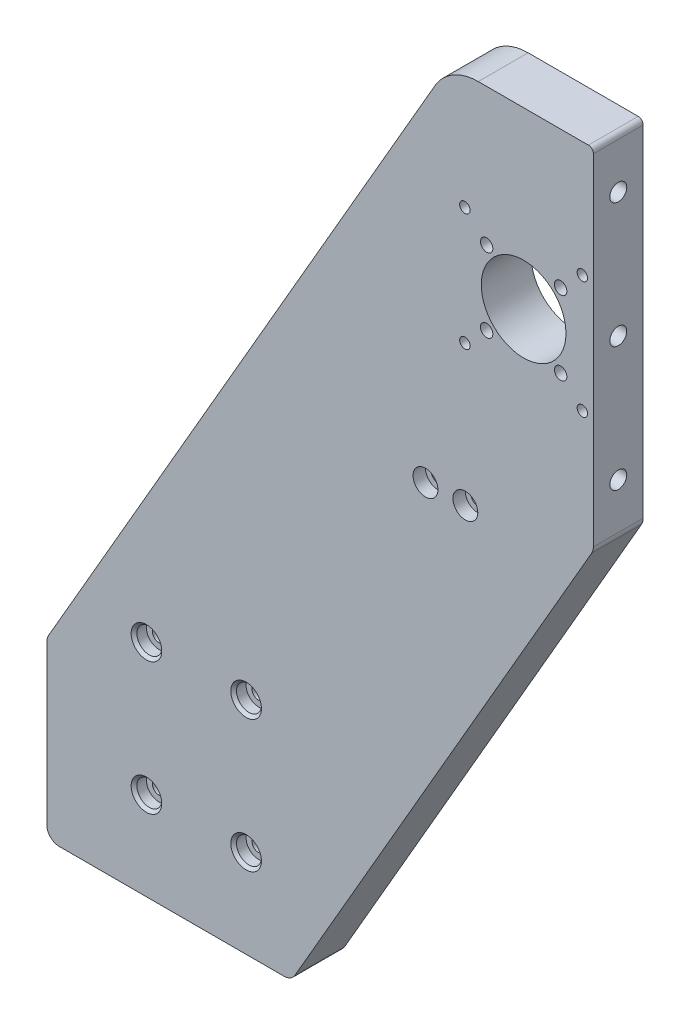
from build123d import *

# Parameters (mm, degrees)
SCHIZZO1_R                     = 17
SCHIZZO1_R_2                   = 2.5
ESTRUSIONE_ESTRUSIONE2_DEPTH   = 20
M5_TAPPED_HOLE1_D              = 4.2
M5_TAPPED_HOLE1_DEPTH          = 17.4
M5_TAPPED_HOLE1_TIP            = 1.2618073
CBORE_FOR_M5_SHCS1_AT_2_COUNT  = 2
CBORE_FOR_M5_SHCS1_AT_2_PITCH  = 53
CBORE_FOR_M5_SHCS1_AT_3_COUNT  = 2
CBORE_FOR_M5_SHCS1_AT_3_PITCH  = 66.400301204
CBORE_FOR_M5_SHCS1_AT_4_COUNT  = 2
CBORE_FOR_M5_SHCS1_AT_4_PITCH  = 40
M8_TAPPED_HOLE1_D              = 6.8
M8_TAPPED_HOLE1_DEPTH          = 15.75
M8_TAPPED_HOLE1_TIP            = 2.042926105
M5_TAPPED_HOLE2_D              = 4.2
CBORE_FOR_M5_SHCS2_D           = 5.3
CBORE_FOR_M5_SHCS2_CBORE_D     = 10
CBORE_FOR_M5_SHCS2_CBORE_DEPTH = 5


with BuildPart() as part:
    # Schizzo1 → Estrusione-Estrusione2 (new body)
    with BuildSketch(Plane.XY):
        with BuildLine():
            Line((5, 0), (95.262794416, 0))
            ThreePointArc((95.262794416, 0), (97.762794416, 0.669872981), (99.592921435, 2.5))
            Line((99.592921435, 2.5), (218.723229311, 208.839745962))
            ThreePointArc((218.723229311, 208.839745962), (219.222731424, 210.045650737), (219.393102292, 211.339745962))
            Line((219.393102292, 211.339745962), (219.393102292, 348))
            ThreePointArc((219.393102292, 348), (218.807315854, 349.414213562), (217.393102292, 350))
            Line((217.393102292, 350), (173.205080757, 350))
            ThreePointArc((173.205080757, 350), (163.205080757, 347.320508076), (155.884572681, 340))
            Line((155.884572681, 340), (0.669872981, 71.160254038))
            ThreePointArc((0.669872981, 71.160254038), (0.170370869, 69.954349263), (0, 68.660254038))
            Line((0, 68.660254038), (0, 5))
            ThreePointArc((0, 5), (1.464466094, 1.464466094), (5, 0))
        make_face()
        with Locations((191.393102292, 280)):
            Circle(SCHIZZO1_R, mode=Mode.SUBTRACT)
        with Locations((206.242344697, 294.849242405)):
            Circle(SCHIZZO1_R_2, mode=Mode.SUBTRACT)
        with Locations((206.242344697, 265.150757595)):
            Circle(SCHIZZO1_R_2, mode=Mode.SUBTRACT)
        with Locations((176.543859887, 265.150757595)):
            Circle(SCHIZZO1_R_2, mode=Mode.SUBTRACT)
        with Locations((176.543859887, 294.849242405)):
            Circle(SCHIZZO1_R_2, mode=Mode.SUBTRACT)
    extrude(amount=-ESTRUSIONE_ESTRUSIONE2_DEPTH)

    # M5 Tapped Hole1
    with Locations(Plane(origin=(50.131397208, 0, -10), x_dir=(0, 0, -1), z_dir=(0, -1, 0))):
        with Locations((0, 0), (0, 35), (0, -35)):
            Hole(M5_TAPPED_HOLE1_D / 2, depth=M5_TAPPED_HOLE1_DEPTH)
            with Locations((0, 0, -(M5_TAPPED_HOLE1_DEPTH + M5_TAPPED_HOLE1_TIP / 2))):  # 118° drill point
                Cone(0, M5_TAPPED_HOLE1_D / 2, M5_TAPPED_HOLE1_TIP, mode=Mode.SUBTRACT)

    # Sketch5 → CBORE for M5 SHCS1 (revolve, cut)
    with BuildSketch(Plane(origin=(80, 88.5, 0), x_dir=(0, -1, 0), z_dir=(1, 0, 0))):
        Polygon((0, 0), (0, 20), (2.65, 20), (2.65, 5), (5, 5), (5, 1.145), (6.145, 0), align=None)
    cbore_for_m5_shcs1 = revolve(axis=Axis((80, 88.5, 6.35), (0, 0, -1)), mode=Mode.SUBTRACT)

    # CBORE for M5 SHCS1 at 2: CBORE for M5 SHCS1 ×2
    with Locations(*[(0, -i * CBORE_FOR_M5_SHCS1_AT_2_PITCH, 0) for i in range(1, CBORE_FOR_M5_SHCS1_AT_2_COUNT)]):
        add(cbore_for_m5_shcs1, mode=Mode.SUBTRACT)

    # CBORE for M5 SHCS1 at 3: CBORE for M5 SHCS1 ×2
    with Locations(*[Vector(-0.6024069059118463, -0.7981891503332503, 0) * (i * CBORE_FOR_M5_SHCS1_AT_3_PITCH) for i in range(1, CBORE_FOR_M5_SHCS1_AT_3_COUNT)]):
        add(cbore_for_m5_shcs1, mode=Mode.SUBTRACT)

    # CBORE for M5 SHCS1 at 4: CBORE for M5 SHCS1 ×2
    with Locations(*[(-i * CBORE_FOR_M5_SHCS1_AT_4_PITCH, 0, 0) for i in range(1, CBORE_FOR_M5_SHCS1_AT_4_COUNT)]):
        add(cbore_for_m5_shcs1, mode=Mode.SUBTRACT)

    # M8 Tapped Hole1
    with Locations(Plane(origin=(219.393102292, 329.669872981, -10), x_dir=(0, 0, 1), z_dir=(1, 0, 0))):
        with Locations((0, 0), (0, 50), (0, 100)):
            Hole(M8_TAPPED_HOLE1_D / 2, depth=M8_TAPPED_HOLE1_DEPTH)
            with Locations((0, 0, -(M8_TAPPED_HOLE1_DEPTH + M8_TAPPED_HOLE1_TIP / 2))):  # 118° drill point
                Cone(0, M8_TAPPED_HOLE1_D / 2, M8_TAPPED_HOLE1_TIP, mode=Mode.SUBTRACT)

    # M5 Tapped Hole2 (through all)
    with Locations(Plane(origin=(214.963102292, 303.57, 0), x_dir=(1, 0, 0), z_dir=(0, 0, 1))):
        with Locations((0, 0), (-47.14, 0), (-47.14, -47.14), (0, -47.14)):
            Hole(M5_TAPPED_HOLE2_D / 2)

    # CBORE for M5 SHCS2 (through all)
    with Locations(Plane(origin=(152, 200, 0), x_dir=(1, 0, 0), z_dir=(0, 0, 1))):
        with Locations((0, 0), (16, 0)):
            CounterBoreHole(CBORE_FOR_M5_SHCS2_D / 2, CBORE_FOR_M5_SHCS2_CBORE_D / 2, CBORE_FOR_M5_SHCS2_CBORE_DEPTH)


solid = part.part
